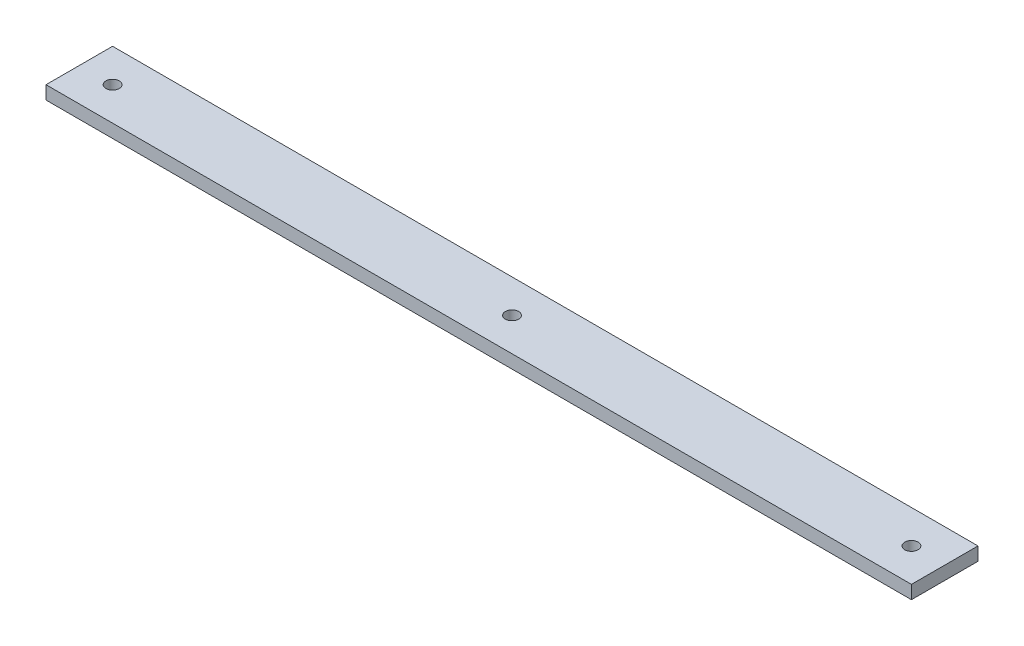
from build123d import *

# Parameters (mm, degrees)
SKETCH1_R           = 2
BOSS_EXTRUDE1_DEPTH = 4


with BuildPart() as part:
    # Sketch1 → Boss-Extrude1 (new body)
    with BuildSketch(Plane(origin=(0, 0, 0), x_dir=(1, 0, 0), z_dir=(0, 1, 0))):
        Polygon((130, 10), (-130, 10), (-130, 5), (-130, -10), (130, -10), align=None)
        Circle(SKETCH1_R, mode=Mode.SUBTRACT)
        with Locations((-120, 0)):
            Circle(SKETCH1_R, mode=Mode.SUBTRACT)
        with Locations((120, 0)):
            Circle(SKETCH1_R, mode=Mode.SUBTRACT)
    extrude(amount=BOSS_EXTRUDE1_DEPTH)


solid = part.part
